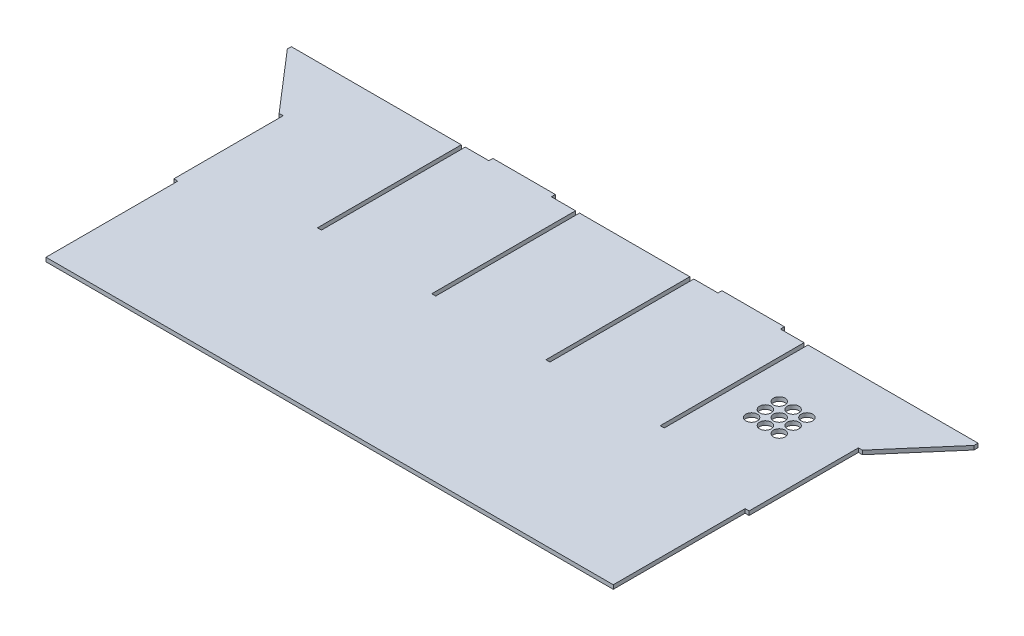
from build123d import *

# Parameters (mm, degrees)
SKETCH1_W                    = 457.2020066
SKETCH1_H                    = 3.175
BOSS_EXTRUDE1_DEPTH          = 242.425000036
SKETCH2_W                    = 3.175
SKETCH2_H                    = 114.3
CUT_EXTRUDE1_DEPTH           = 334.224218774
LPATTERN1_COUNT              = 4
LPATTERN1_PITCH              = 90.807
SKETCH3_W                    = 49.658811606
SKETCH3_H                    = 3.175
BOSS_EXTRUDE2_DEPTH          = 3.175
BOSS_EXTRUDE3_DEPTH          = 3.175
SKETCH5_W                    = 3.175
SKETCH5_H                    = 104.775
CUT_EXTRUDE2_DEPTH           = 3.175
SKETCH24_R                   = 0.063692751
SKETCH24_R_2                 = 4.647993858
CUT_EXTRUDE7_DEPTH           = 366.022293079
LPATTERN17_COUNT             = 3
LPATTERN17_PITCH             = 11
LPATTERN18_COPY_1_SKETCH_R   = 0.063692751
LPATTERN18_COPY_1_SKETCH_R_2 = 4.647993858
LPATTERN18_COPY_1_DEPTH      = 366.022293079
LPATTERN18_COPY_2_SKETCH_R   = 0.063692751
LPATTERN18_COPY_2_SKETCH_R_2 = 4.647993858
LPATTERN18_COPY_2_DEPTH      = 366.022293079
LPATTERN18_COPY_3_SKETCH_R   = 0.063692751
LPATTERN18_COPY_3_SKETCH_R_2 = 4.647993858
LPATTERN18_COPY_3_DEPTH      = 366.022293079
LPATTERN18_COPY_4_SKETCH_R   = 0.063692751
LPATTERN18_COPY_4_SKETCH_R_2 = 4.647993858
LPATTERN18_COPY_4_DEPTH      = 366.022293079
LPATTERN18_COPY_5_SKETCH_R   = 0.063692751
LPATTERN18_COPY_5_SKETCH_R_2 = 4.647993858
LPATTERN18_COPY_5_DEPTH      = 366.022293079
LPATTERN18_COPY_6_SKETCH_R   = 0.063692751
LPATTERN18_COPY_6_SKETCH_R_2 = 4.647993858
LPATTERN18_COPY_6_DEPTH      = 366.022293079


with BuildPart() as part:
    # Sketch1 → Boss-Extrude1 (new body)
    with BuildSketch(Plane.XY):
        Rectangle(SKETCH1_W, SKETCH1_H)
    extrude(amount=BOSS_EXTRUDE1_DEPTH)

    # Sketch2 → Cut-Extrude1 (cut, through all)
    with BuildSketch(Plane(origin=(0, 1.5875, 0), x_dir=(1, 0, 0), z_dir=(0, 1, 0))):
        with Locations((136.2085033, -57.15)):
            Rectangle(SKETCH2_W, SKETCH2_H)
    cut_extrude1 = extrude(amount=-CUT_EXTRUDE1_DEPTH, mode=Mode.SUBTRACT)

    # LPattern1: Cut-Extrude1 ×4
    with Locations(*[(-i * LPATTERN1_PITCH, 0, 0) for i in range(1, LPATTERN1_COUNT)]):
        add(cut_extrude1, mode=Mode.SUBTRACT)

    # Sketch3 → Boss-Extrude2 (add)
    with BuildSketch(Plane(origin=(0, 0, 0), x_dir=(-1, 0, 0), z_dir=(0, 0, -1))):
        with Locations((-91.020094169, 0)):
            Rectangle(SKETCH3_W, SKETCH3_H)
        with Locations((91.020094169, 0)):
            Rectangle(SKETCH3_W, SKETCH3_H)
    extrude(amount=BOSS_EXTRUDE2_DEPTH)

    # Sketch4 → Boss-Extrude3 (add)
    with BuildSketch(Plane.XZ.offset(1.5875)):
        Polygon((-228.6010033, 0), (-272.8760033, 0), (-272.8760033, 3.175), (-231.7760033, 50.8), (-228.6010033, 50.8), align=None)
    boss_extrude3 = extrude(amount=-BOSS_EXTRUDE3_DEPTH)

    # Mirror1: Boss-Extrude3 across plane
    add(boss_extrude3.mirror(Plane(origin=(0, 0, 0), x_dir=(0, 0, 1), z_dir=(1, 0, 0))))

    # Sketch5 → Cut-Extrude2 (cut)
    with BuildSketch(Plane.XZ.offset(1.5875)):
        with Locations((-227.0135033, 190.037500036)):
            Rectangle(SKETCH5_W, SKETCH5_H)
    cut_extrude2 = extrude(amount=-CUT_EXTRUDE2_DEPTH, mode=Mode.SUBTRACT)

    # Mirror2: Cut-Extrude2 across plane
    add(cut_extrude2.mirror(Plane(origin=(0, 0, 0), x_dir=(0, 0, 1), z_dir=(1, 0, 0))), mode=Mode.SUBTRACT)

    # Sketch24 → Cut-Extrude7 (cut, through all)
    with BuildSketch(Plane(origin=(0, 1.5875, 0), x_dir=(1, 0, 0), z_dir=(0, 1, 0))):
        with Locations((168.18842042, -46.036559305)):
            Circle(SKETCH24_R)
        with Locations((165.281751842, -50.363644406)):
            Circle(SKETCH24_R_2)
    cut_extrude7 = extrude(amount=-CUT_EXTRUDE7_DEPTH, mode=Mode.SUBTRACT)

    # LPattern17: Cut-Extrude7 ×3
    with Locations(*[(i * LPATTERN17_PITCH, 0, 0) for i in range(1, LPATTERN17_COUNT)]):
        add(cut_extrude7, mode=Mode.SUBTRACT)

    # LPattern18 copy 1 sketch → LPattern18 copy 1 (cut, through all)
    with BuildSketch(Plane(origin=(11, 1.5875, 11), x_dir=(1, 0, 0), z_dir=(0, 1, 0))):
        with Locations((168.18842042, -46.036559305)):
            Circle(LPATTERN18_COPY_1_SKETCH_R)
        with Locations((165.281751842, -50.363644406)):
            Circle(LPATTERN18_COPY_1_SKETCH_R_2)
    extrude(amount=-LPATTERN18_COPY_1_DEPTH, mode=Mode.SUBTRACT)

    # LPattern18 copy 2 sketch → LPattern18 copy 2 (cut, through all)
    with BuildSketch(Plane(origin=(11, 1.5875, 22), x_dir=(1, 0, 0), z_dir=(0, 1, 0))):
        with Locations((168.18842042, -46.036559305)):
            Circle(LPATTERN18_COPY_2_SKETCH_R)
        with Locations((165.281751842, -50.363644406)):
            Circle(LPATTERN18_COPY_2_SKETCH_R_2)
    extrude(amount=-LPATTERN18_COPY_2_DEPTH, mode=Mode.SUBTRACT)

    # LPattern18 copy 3 sketch → LPattern18 copy 3 (cut, through all)
    with BuildSketch(Plane(origin=(22, 1.5875, 11), x_dir=(1, 0, 0), z_dir=(0, 1, 0))):
        with Locations((168.18842042, -46.036559305)):
            Circle(LPATTERN18_COPY_3_SKETCH_R)
        with Locations((165.281751842, -50.363644406)):
            Circle(LPATTERN18_COPY_3_SKETCH_R_2)
    extrude(amount=-LPATTERN18_COPY_3_DEPTH, mode=Mode.SUBTRACT)

    # LPattern18 copy 4 sketch → LPattern18 copy 4 (cut, through all)
    with BuildSketch(Plane(origin=(22, 1.5875, 22), x_dir=(1, 0, 0), z_dir=(0, 1, 0))):
        with Locations((168.18842042, -46.036559305)):
            Circle(LPATTERN18_COPY_4_SKETCH_R)
        with Locations((165.281751842, -50.363644406)):
            Circle(LPATTERN18_COPY_4_SKETCH_R_2)
    extrude(amount=-LPATTERN18_COPY_4_DEPTH, mode=Mode.SUBTRACT)

    # LPattern18 copy 5 sketch → LPattern18 copy 5 (cut, through all)
    with BuildSketch(Plane(origin=(0, 1.5875, 11), x_dir=(1, 0, 0), z_dir=(0, 1, 0))):
        with Locations((168.18842042, -46.036559305)):
            Circle(LPATTERN18_COPY_5_SKETCH_R)
        with Locations((165.281751842, -50.363644406)):
            Circle(LPATTERN18_COPY_5_SKETCH_R_2)
    extrude(amount=-LPATTERN18_COPY_5_DEPTH, mode=Mode.SUBTRACT)

    # LPattern18 copy 6 sketch → LPattern18 copy 6 (cut, through all)
    with BuildSketch(Plane(origin=(0, 1.5875, 22), x_dir=(1, 0, 0), z_dir=(0, 1, 0))):
        with Locations((168.18842042, -46.036559305)):
            Circle(LPATTERN18_COPY_6_SKETCH_R)
        with Locations((165.281751842, -50.363644406)):
            Circle(LPATTERN18_COPY_6_SKETCH_R_2)
    extrude(amount=-LPATTERN18_COPY_6_DEPTH, mode=Mode.SUBTRACT)


solid = part.part
